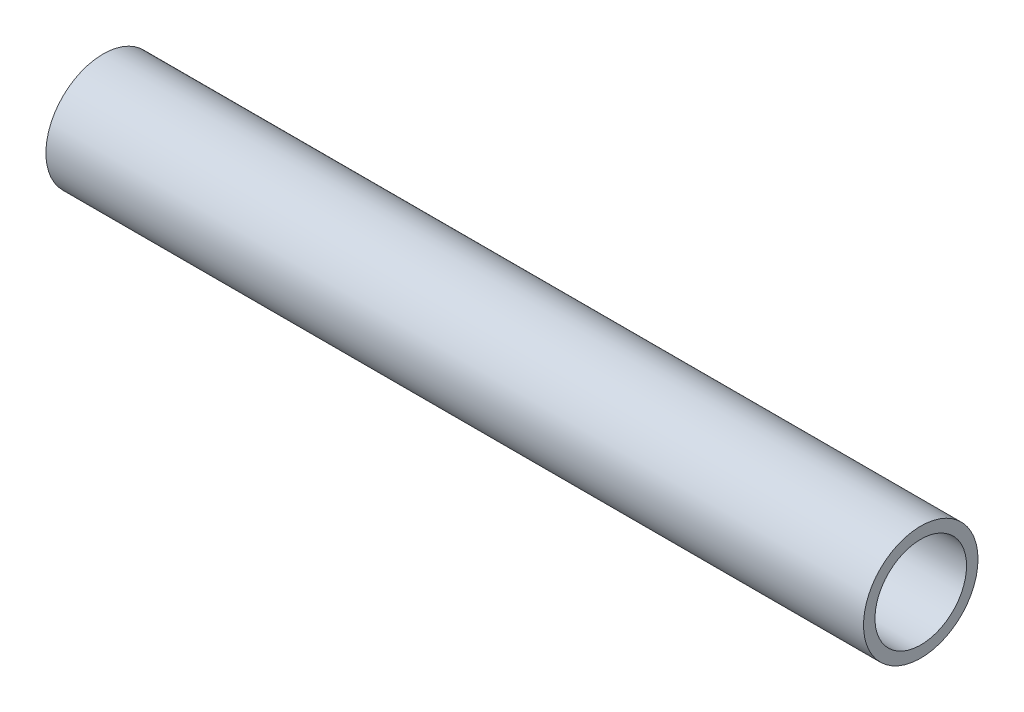
from build123d import *

# Parameters (mm, degrees)
SKETCH1_R           = 15.875
SKETCH1_R_2         = 12.7
EXTRUDE_THIN1_DEPTH = 113.380750124


with BuildPart() as part:
    # Sketch1 → Extrude-Thin1 (new, symmetric)
    with BuildSketch(Plane(origin=(0, 0, 0), x_dir=(0, 0, -1), z_dir=(1, 0, 0))):
        Circle(SKETCH1_R)
        Circle(SKETCH1_R_2, mode=Mode.SUBTRACT)
    extrude(amount=EXTRUDE_THIN1_DEPTH, both=True)


solid = part.part
